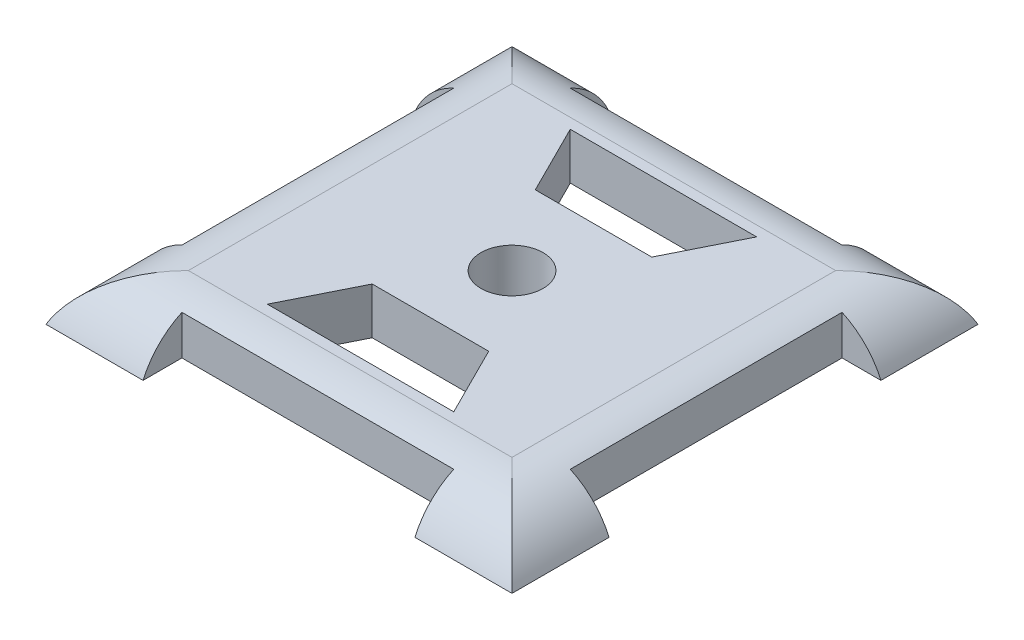
from build123d import *

# Parameters (mm, degrees)
SKETCH_1_W          = 20
SKETCH_1_H          = 20
EXTRUDE_1_DEPTH     = 2
CUT_EXTRUDE_1_DEPTH = 17.713614462
SCALE_1_SCALE       = 0.6
SKETCH_5_W          = 7
SKETCH_5_H          = 1
SKETCH_5_W_2        = 1
SKETCH_5_H_2        = 7
CUT_EXTRUDE_2_DEPTH = 12.05686647
FILLET_1_R          = 2
SKETCH_6_R          = 0.8
CUT_EXTRUDE_3_DEPTH = 12.05686647


with BuildPart() as part:
    # 草图1 → 凸台-拉伸1 (new body)
    with BuildSketch(Plane(origin=(0, 0, 0), x_dir=(1, 0, 0), z_dir=(0, 1, 0))):
        with Locations((-0.331632653, 2.984693878)):
            Rectangle(SKETCH_1_W, SKETCH_1_H)
    extrude(amount=EXTRUDE_1_DEPTH)

    # 草图2 → 切除-拉伸1 (cut, through all)
    with BuildSketch(Plane(origin=(0, 2, 0), x_dir=(1, 0, 0), z_dir=(0, 1, 0))):
        Polygon((-4.331632653, 9.484693878), (3.668367347, 9.484693878), (2.168367347, 6.484693878), (-2.831632653, 6.484693878), align=None)
        Polygon((3.668367347, -3.515306122), (2.168367347, -0.515306122), (-2.831632653, -0.515306122), (-4.331632653, -3.515306122), align=None)
    extrude(amount=-CUT_EXTRUDE_1_DEPTH, mode=Mode.SUBTRACT)


with BuildPart() as part_1:
    # 缩放比例1: scaled about (-0.331632653, 1, -2.984693878)
    add(part.part.scale(SCALE_1_SCALE).moved(Location((-0.132653061, 0.4, -1.193877551))))

    # 草图5 → 切除-拉伸2 (cut, through all)
    with BuildSketch(Plane(origin=(0, 1.6, 0), x_dir=(1, 0, 0), z_dir=(0, 1, 0))):
        with Locations((-0.331632653, -2.515306122)):
            Rectangle(SKETCH_5_W, SKETCH_5_H)
        with Locations((-5.831632653, 2.984693878)):
            Rectangle(SKETCH_5_W_2, SKETCH_5_H_2)
        with Locations((-0.331632653, 8.484693878)):
            Rectangle(SKETCH_5_W, SKETCH_5_H)
        with Locations((5.168367347, 2.984693878)):
            Rectangle(SKETCH_5_W_2, SKETCH_5_H_2)
    extrude(amount=-CUT_EXTRUDE_2_DEPTH, mode=Mode.SUBTRACT)

    # 圆角1
    # the kernel refuses this fillet: 2 mm, written as the material it takes off along each edge
    with BuildSketch(Plane(origin=(5.668367347, 1.6, -4.067269573), x_dir=(-1, 0, 0), z_dir=(0, 0, 1)), Plane(origin=(-1.414208348, 1.6, -8.984693878), x_dir=(0, 0, 1), z_dir=(1, 0, 0)), Plane(origin=(-6.331632653, 1.6, -1.902118183), x_dir=(1, 0, 0), z_dir=(0, 0, -1)), Plane(origin=(-6.331632653, 1.6, 7.597881817), x_dir=(1, 0, 0), z_dir=(0, 0, -1)), Plane(origin=(10.250943042, 1.6, 3.015306122), x_dir=(0, 0, -1), z_dir=(-1, 0, 0)), Plane(origin=(5.668367347, 1.6, -13.567269573), x_dir=(-1, 0, 0), z_dir=(0, 0, 1)), Plane(origin=(0.750943042, 1.6, 3.015306122), x_dir=(0, 0, -1), z_dir=(-1, 0, 0))) as fillet_1_piece_1:
        with BuildLine():
            CenterArc((1.833030278, 2), FILLET_1_R, 203.578178478, 66.421821522)
            Line((0, 1.2), (0, 0))
            Line((0, 0), (1.833030278, 0))
        make_face()
    extrude(amount=11.66515139, mode=Mode.SUBTRACT)
    with BuildSketch(Plane(origin=(-10.914208348, 1.6, -8.984693878), x_dir=(0, -1, 0), z_dir=(1, 0, 0))) as fillet_1_piece_2:
        with BuildLine():
            CenterArc((2, -1.833030278), FILLET_1_R, 113.578178478, 66.421821522)
            Line((0, -1.833030278), (0, 0))
            Line((0, 0), (1.2, 0))
        make_face()
    extrude(amount=11.66515139, mode=Mode.SUBTRACT)

    # 草图6 → 切除-拉伸3 (cut, through all)
    with BuildSketch(Plane.XZ.offset(-0.4)):
        with Locations(Location((-0.331632653, -2.984693878, 0), (0, 0, 270))):
            Circle(SKETCH_6_R)
    extrude(amount=-CUT_EXTRUDE_3_DEPTH, mode=Mode.SUBTRACT)


solid = part_1.part
